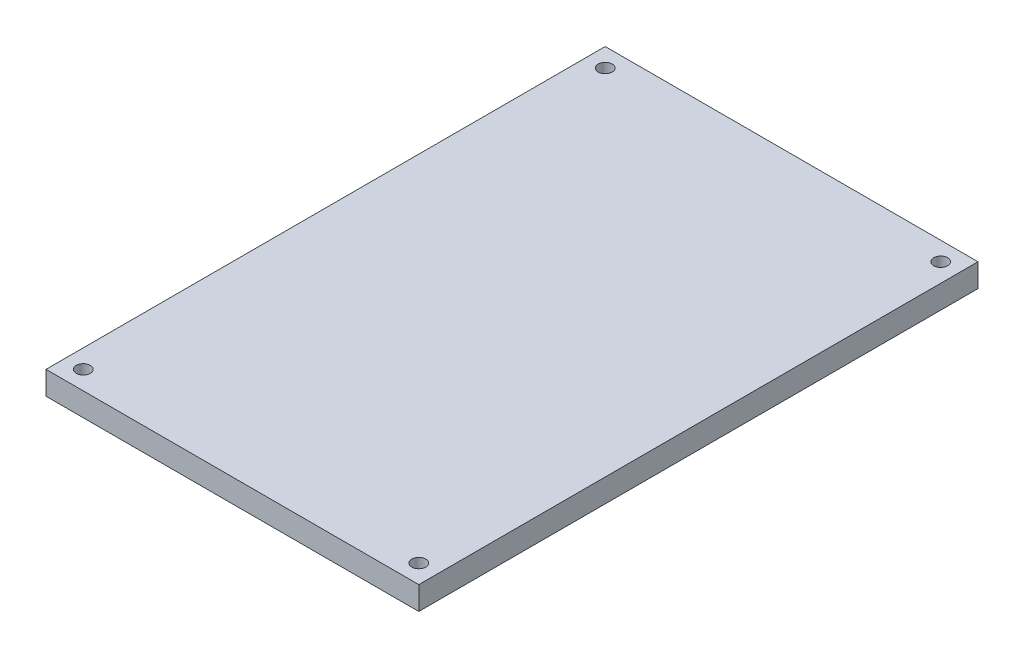
from build123d import *

# Parameters (mm, degrees)
SKETCH1_W           = 80
SKETCH1_H           = 120
BOSS_EXTRUDE1_DEPTH = 5
SKETCH2_R           = 1.5
CUT_EXTRUDE1_DEPTH  = 145.308696897
SKETCH3_R           = 1.5
CUT_EXTRUDE2_DEPTH  = 145.308696897


with BuildPart() as part:
    # Sketch1 → Boss-Extrude1 (new body)
    with BuildSketch(Plane(origin=(0, 0, 0), x_dir=(1, 0, 0), z_dir=(0, 1, 0))):
        with Locations((-40, 60)):
            Rectangle(SKETCH1_W, SKETCH1_H)
    extrude(amount=BOSS_EXTRUDE1_DEPTH)

    # Sketch2 → Cut-Extrude1 (cut, through all)
    with BuildSketch(Plane(origin=(0, 5, 0), x_dir=(1, 0, 0), z_dir=(0, 1, 0))):
        with Locations((-76, 116)):
            Circle(SKETCH2_R)
    cut_extrude1 = extrude(amount=-CUT_EXTRUDE1_DEPTH, mode=Mode.SUBTRACT)

    # Sketch3 → Cut-Extrude2 (cut, through all)
    with BuildSketch(Plane(origin=(0, 5, 0), x_dir=(1, 0, 0), z_dir=(0, 1, 0))):
        with Locations((-4, 116)):
            Circle(SKETCH3_R)
    cut_extrude2 = extrude(amount=-CUT_EXTRUDE2_DEPTH, mode=Mode.SUBTRACT)

    # Mirror1: Cut-Extrude1, Cut-Extrude2 across plane
    add(cut_extrude1.mirror(Plane.XY.offset(-60)), mode=Mode.SUBTRACT)
    add(cut_extrude2.mirror(Plane.XY.offset(-60)), mode=Mode.SUBTRACT)


solid = part.part
